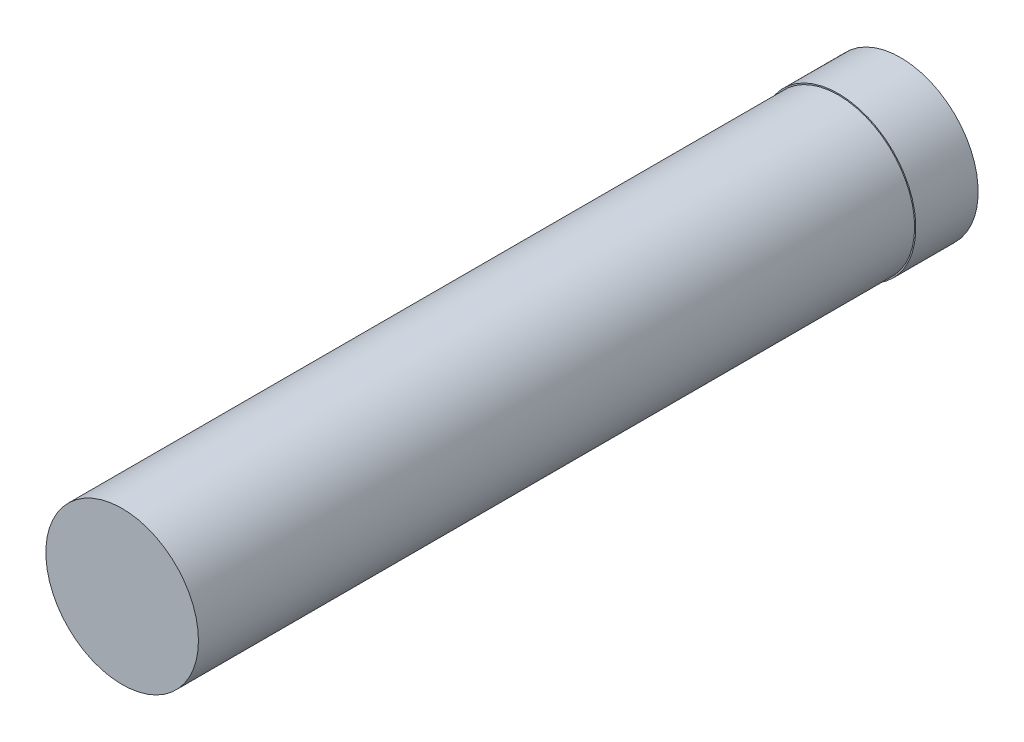
from build123d import *

# Parameters (mm, degrees)
BOSS_EXTRUDE1_DEPTH      = 15
BOSS_EXTRUDE1_DEPTH_BACK = 10
SKETCH1_R                = 2.45
SKETCH3_R                = 2.49
BOSS_EXTRUDE2_DEPTH      = 2


with BuildPart() as part:
    # Sketch1 → Boss-Extrude1 (new, two sides: drawn at the far end of the back side and taken through both)
    with BuildSketch(Plane.XY.offset(-BOSS_EXTRUDE1_DEPTH_BACK)):
        Circle(SKETCH1_R)
    extrude(amount=BOSS_EXTRUDE1_DEPTH + BOSS_EXTRUDE1_DEPTH_BACK)

    # Sketch3 → Boss-Extrude2 (add)
    with BuildSketch(Plane(origin=(0, 0, -10), x_dir=(-1, 0, 0), z_dir=(0, 0, -1))):
        Circle(SKETCH3_R)
    extrude(amount=-BOSS_EXTRUDE2_DEPTH)


solid = part.part
